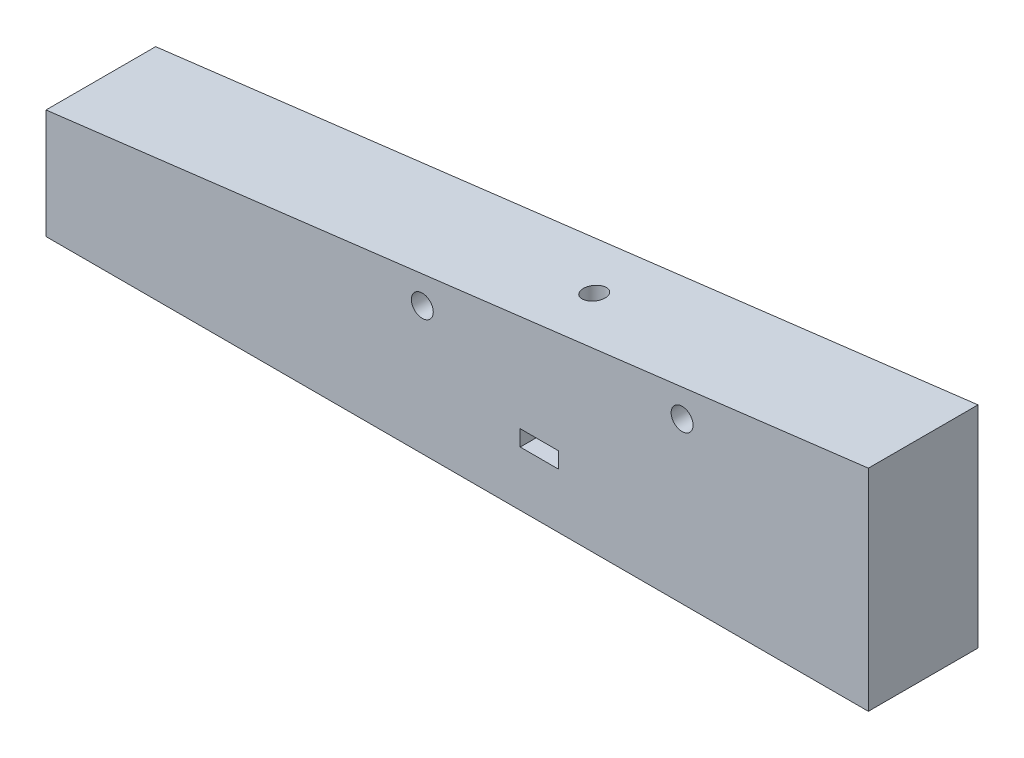
from build123d import *

# Parameters (mm, degrees)
SKETCH1_W               = 150
SKETCH1_H               = 20
BOSS_EXTRUDE1_DEPTH     = 10
BOSS_EXTRUDE2_DEPTH     = 10
CUT_EXTRUDE1_DEPTH      = 85.858225614
CUT_EXTRUDE1_DEPTH_BACK = 85.858225614
SKETCH4_R               = 2
CUT_EXTRUDE2_DEPTH      = 83.65932961
CUT_EXTRUDE2_DEPTH_BACK = 83.65932961
SKETCH5_R               = 2
SKETCH5_3_W             = 7
SKETCH5_3_H             = 2.9
CUT_EXTRUDE3_DEPTH      = 13.8


with BuildPart() as part:
    # Sketch1 → Boss-Extrude1 (new, symmetric)
    with BuildSketch(Plane(origin=(0, 0, 0), x_dir=(1, 0, 0), z_dir=(0, 1, 0))):
        Rectangle(SKETCH1_W, SKETCH1_H)
    extrude(amount=BOSS_EXTRUDE1_DEPTH, both=True)

    # Sketch2 → Boss-Extrude2 (add, symmetric)
    with BuildSketch(Plane.XY):
        Polygon((-75, 10), (75, 10), (75, 28.417684135), align=None)
    extrude(amount=BOSS_EXTRUDE2_DEPTH, both=True)

    # Sketch4 → Cut-Extrude1 (cut, two sides: drawn at the far end of the back side and taken through both)
    with BuildSketch(Plane.XZ.offset(10).offset(-CUT_EXTRUDE1_DEPTH_BACK)):
        with Locations((15, 0)):
            Circle(SKETCH4_R)
    extrude(amount=CUT_EXTRUDE1_DEPTH + CUT_EXTRUDE1_DEPTH_BACK, mode=Mode.SUBTRACT)

    # Sketch5 → Cut-Extrude2 (cut, two sides: drawn at the far end of the back side and taken through both)
    with BuildSketch(Plane.XY.offset(10).offset(-CUT_EXTRUDE2_DEPTH_BACK)):
        with Locations((-6.361121016, 13.39024549)):
            Circle(SKETCH5_R)
        with Locations((41.025490892, 19.208589825)):
            Circle(SKETCH5_R)
    extrude(amount=CUT_EXTRUDE2_DEPTH + CUT_EXTRUDE2_DEPTH_BACK, mode=Mode.SUBTRACT)

    # Sketch5<3> → Cut-Extrude3 (cut)
    with BuildSketch(Plane.XY.offset(10)):
        with Locations((15, 1.45)):
            Rectangle(SKETCH5_3_W, SKETCH5_3_H)
    extrude(amount=-CUT_EXTRUDE3_DEPTH, mode=Mode.SUBTRACT)


solid = part.part
